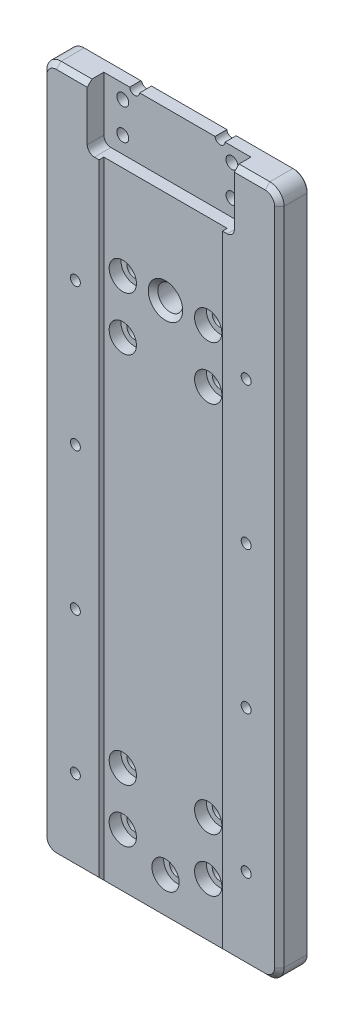
from build123d import *

# Parameters (mm, degrees)
SKETCH1_W               = 100
SKETCH1_H               = 290
BOSS_EXTRUDE1_DEPTH     = 6
SKETCH2_W               = 62
SKETCH2_H               = 26
CUT_EXTRUDE1_DEPTH      = 7
SKETCH3_W               = 52
SKETCH3_H               = 290
CUT_EXTRUDE2_DEPTH      = 2
SKETCH4_R               = 2.5
SKETCH4_R_2             = 5.25
SKETCH4_R_3             = 2.1
SKETCH4_R_4             = 3.3
CUT_EXTRUDE_HOLES_DEPTH = 21
FILLET1_R               = 3
FILLET2_R               = 6
CHAMFER1_SIZE           = 2
SKETCH5_R               = 5.75
CUT_EXTRUDE5_DEPTH      = 5
CHAMFER2_SIZE           = 2
CHAMFER3_SIZE           = 0.3


with BuildPart() as part:
    # Sketch1 → Boss-Extrude1 (new, symmetric)
    with BuildSketch(Plane.XY):
        Rectangle(SKETCH1_W, SKETCH1_H)
    extrude(amount=BOSS_EXTRUDE1_DEPTH, both=True)

    # Sketch2 → Cut-Extrude1 (cut)
    with BuildSketch(Plane.XY.offset(6)):
        with Locations((0, 132)):
            Rectangle(SKETCH2_W, SKETCH2_H)
    extrude(amount=-CUT_EXTRUDE1_DEPTH, mode=Mode.SUBTRACT)

    # Sketch3 → Cut-Extrude2 (cut)
    with BuildSketch(Plane.XY.offset(6)):
        Rectangle(SKETCH3_W, SKETCH3_H)
    extrude(amount=-CUT_EXTRUDE2_DEPTH, mode=Mode.SUBTRACT)

    # Sketch4 → Cut-Extrude HOLES (cut)
    with BuildSketch(Plane.XY.offset(-6)):
        with Locations((-23, 139)):
            Circle(SKETCH4_R)
        with Locations((23, 139)):
            Circle(SKETCH4_R)
        with Locations((23, 126)):
            Circle(SKETCH4_R)
        with Locations((-23, 126)):
            Circle(SKETCH4_R)
        with Locations((0, 79.64)):
            Circle(SKETCH4_R_2)
        with Locations((-18, 145.14)):
            Circle(SKETCH4_R_3)
        with Locations((-18, 79.64)):
            Circle(SKETCH4_R_4)
        with Locations((-18, 57.14)):
            Circle(SKETCH4_R_4)
        with Locations((-36, 70)):
            Circle(SKETCH4_R_3)
        with Locations((-36, 10)):
            Circle(SKETCH4_R_3)
        with Locations((-36, -110)):
            Circle(SKETCH4_R_3)
        with Locations((-36, -50)):
            Circle(SKETCH4_R_3)
        with Locations((-18, -100)):
            Circle(SKETCH4_R_4)
        with Locations((-18, -122.5)):
            Circle(SKETCH4_R_4)
        with Locations((18, -100)):
            Circle(SKETCH4_R_4)
        with Locations((18, -122.5)):
            Circle(SKETCH4_R_4)
        with Locations((0, -130)):
            Circle(SKETCH4_R_4)
        with Locations((36, 70)):
            Circle(SKETCH4_R_3)
        with Locations((18, 145.14)):
            Circle(SKETCH4_R_3)
        with Locations((18, 57.14)):
            Circle(SKETCH4_R_4)
        with Locations((18, 79.64)):
            Circle(SKETCH4_R_4)
        with Locations((36, 10)):
            Circle(SKETCH4_R_3)
        with Locations((36, -50)):
            Circle(SKETCH4_R_3)
        with Locations((36, -110)):
            Circle(SKETCH4_R_3)
    extrude(amount=CUT_EXTRUDE_HOLES_DEPTH, mode=Mode.SUBTRACT)

    # Fillet1
    fillet1_edges = [part.edges().sort_by_distance(p)[0] for p in [
        (31, 119, 2.5),
        (-31, 119, 2.5),
    ]]
    fillet(fillet1_edges, radius=FILLET1_R)

    # Fillet2
    fillet2_edges = [part.edges().sort_by_distance(p)[0] for p in [
        (50, -145, 0),
        (-50, -145, 0),
        (50, 145, 0),
        (-50, 145, 0),
    ]]
    fillet(fillet2_edges, radius=FILLET2_R)

    # Chamfer1
    chamfer1_edges = [part.edges().sort_by_distance(p)[0] for p in [
        (35, -145, 6),
        (48.242640687, -143.242640687, 6),
        (50, 0, 6),
        (48.242640687, 143.242640687, 6),
        (37.5, 145, 6),
        (-35, -145, 6),
        (-48.242640687, -143.242640687, 6),
        (-50, 0, 6),
        (-48.242640687, 143.242640687, 6),
        (-37.5, 145, 6),
    ]]
    chamfer(chamfer1_edges, length=CHAMFER1_SIZE)

    # Sketch5 → Cut-Extrude5 (cut)
    with BuildSketch(Plane.XY.offset(4)):
        with Locations((-18, 79.64)):
            Circle(SKETCH5_R)
        with Locations((-18, 57.14)):
            Circle(SKETCH5_R)
        with Locations((18, 57.14)):
            Circle(SKETCH5_R)
        with Locations((18, 79.64)):
            Circle(SKETCH5_R)
        with Locations((18, -100)):
            Circle(SKETCH5_R)
        with Locations((-18, -100)):
            Circle(SKETCH5_R)
        with Locations((-18, -122.5)):
            Circle(SKETCH5_R)
        with Locations((0, -130)):
            Circle(SKETCH5_R)
        with Locations((18, -122.5)):
            Circle(SKETCH5_R)
    extrude(amount=-CUT_EXTRUDE5_DEPTH, mode=Mode.SUBTRACT)

    # Chamfer2
    chamfer2_edges = [part.edges().sort_by_distance(p)[0] for p in [
        (-5.25, 79.64, 4),
    ]]
    chamfer(chamfer2_edges, length=CHAMFER2_SIZE)

    # Chamfer3
    chamfer3_edges = [part.edges().sort_by_distance(p)[0] for p in [
        (-50, 0, -6),
        (-48.242640687, -143.242640687, -6),
        (-48.242640687, 143.242640687, -6),
        (0, -145, -6),
        (48.242640687, -143.242640687, -6),
        (48.242640687, 143.242640687, -6),
        (50, 0, -6),
        (-32.047664068, 145, -6),
    ]]
    chamfer(chamfer3_edges, length=CHAMFER3_SIZE)


solid = part.part
